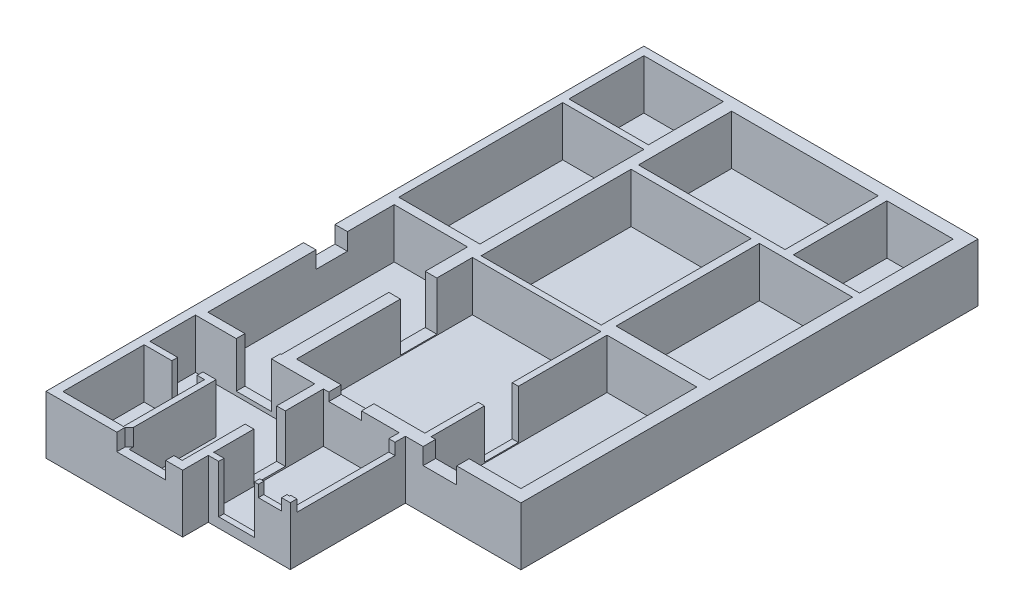
from build123d import *

# Parameters (mm, degrees)
SKETCH_1_W             = 1920
SKETCH_1_H             = 1810
SKETCH_1_W_2           = 1960
SKETCH_1_H_2           = 3960
SKETCH_1_W_3           = 1600
SKETCH_1_H_3           = 2260
SKETCH_1_W_4           = 2170
SKETCH_1_H_4           = 4250
SKETCH_1_W_5           = 3540
SKETCH_1_H_5           = 2250
SKETCH_1_W_6           = 2250
SKETCH_1_H_6           = 3460
SKETCH_1_W_7           = 2900
SKETCH_1_H_7           = 3620
SKETCH_1_W_8           = 1460
SKETCH_1_H_8           = 1960
SKETCH_1_W_9           = 1830
SKETCH_1_H_9           = 2650
SKETCH_1_W_10          = 3100
SKETCH_1_W_11          = 1770
SKETCH_1_H_10          = 4500
EXTRUDE_1796_DEPTH     = 2580
EXTRUDE_2026_DEPTH     = 200
SKETCH_5_W             = 760
SKETCH_5_H             = 1290
CUT_EXTRUDE_2294_DEPTH = 12730.50759415
SKETCH_7_W             = 1180
SKETCH_7_H             = 1220
CUT_EXTRUDE_2534_DEPTH = 15092.53046452
CHAMFER_1_SIZE         = 100
CUT_EXTRUDE_2822_REACH = 12120.51
SKETCH_10_W            = 790
SKETCH_10_H            = 1070
CUT_EXTRUDE_3074_REACH = 14575.702
SKETCH_11_W            = 860
SKETCH_11_H            = 1930
CUT_EXTRUDE_3320_REACH = 13130.454
SKETCH_12_W            = 610
SKETCH_12_H            = 1730
CUT_EXTRUDE_3576_REACH = 11929.514
SKETCH_13_W            = 850
SKETCH_13_H            = 1850
CUT_EXTRUDE_3824_REACH = 11735.178
SKETCH_15_W            = 880
SKETCH_15_H            = 1775
CUT_EXTRUDE_4057_REACH = 11847.855
SKETCH_16_W            = 810
SKETCH_16_H            = 1240
CUT_EXTRUDE_4303_REACH = 11463.674
SKETCH_17_W            = 820
SKETCH_17_H            = 2055
CUT_EXTRUDE_4598_REACH = 14575.702
SKETCH_19_W            = 560
SKETCH_19_H            = 1150
CUT_EXTRUDE_4844_REACH = 11315.017
SKETCH_20_W            = 2370
SKETCH_20_H            = 1150
CUT_EXTRUDE_5188_REACH = 11247.793
SKETCH_22_W            = 760
SKETCH_22_H            = 1890
SKETCH_21_W            = 8095.85133769
SKETCH_21_H            = 14487.658310263
CUT_EXTRUDE_5242_DEPTH = 1380


with BuildPart() as part:
    # Эскиз1 → Extrude 1796 (new body)
    with BuildSketch(Plane(origin=(0, 0, 0), x_dir=(1, 0, 0), z_dir=(0, 1, 0))):
        Polygon((-3789.779005525, -9747.361878453), (-489.779005525, -9747.361878453), (-489.779005525, -9127.361878453), (1490.220994475, -9127.361878453), (1490.220994475, -6347.361878453), (4280.220994475, -6347.361878453), (4280.220994475, 4692.638121547), (-3789.779005525, 4692.638121547), align=None)
        with Locations((-2629.779005525, 3587.638121547)):
            Rectangle(SKETCH_1_W, SKETCH_1_H, mode=Mode.SUBTRACT)
        with Locations((-2609.779005525, 552.638121547)):
            Rectangle(SKETCH_1_W_2, SKETCH_1_H_2, mode=Mode.SUBTRACT)
        with Locations((3180.220994475, 3262.638121547)):
            Rectangle(SKETCH_1_W_3, SKETCH_1_H_3, mode=Mode.SUBTRACT)
        with Locations((2895.220994475, -3922.361878453)):
            Rectangle(SKETCH_1_W_4, SKETCH_1_H_4, mode=Mode.SUBTRACT)
        with Locations((400.220994475, 3267.638121547)):
            Rectangle(SKETCH_1_W_5, SKETCH_1_H_5, mode=Mode.SUBTRACT)
        with Locations((2855.220994475, 232.638121547)):
            Rectangle(SKETCH_1_W_6, SKETCH_1_H_6, mode=Mode.SUBTRACT)
        with Locations((80.220994475, 152.638121547)):
            Rectangle(SKETCH_1_W_7, SKETCH_1_H_7, mode=Mode.SUBTRACT)
        Polygon((-699.779005525, -6347.361878453), (-699.779005525, -9547.361878453), (-1979.779005525, -9547.361878453), (-1979.779005525, -7447.361878453), (-3579.779005525, -7447.361878453), (-3579.779005525, -6347.361878453), align=None, mode=Mode.SUBTRACT)
        with Locations((-2849.779005525, -8567.361878453)):
            Rectangle(SKETCH_1_W_8, SKETCH_1_H_8, mode=Mode.SUBTRACT)
        with Locations((425.220994475, -7672.361878453)):
            Rectangle(SKETCH_1_W_9, SKETCH_1_H_9, mode=Mode.SUBTRACT)
        with Locations((110.220994475, -3922.361878453)):
            Rectangle(SKETCH_1_W_10, SKETCH_1_H_4, mode=Mode.SUBTRACT)
        with Locations((-2604.779005525, -3887.361878453)):
            Rectangle(SKETCH_1_W_11, SKETCH_1_H_10, mode=Mode.SUBTRACT)
    extrude(amount=EXTRUDE_1796_DEPTH)

    # Эскиз4 → Extrude 2026 (add)
    with BuildSketch(Plane(origin=(0, 0, 0), x_dir=(1, 0, 0), z_dir=(0, 1, 0))):
        Polygon((-3789.779005525, 4692.638121547), (4280.220994475, 4692.638121547), (4280.220994475, -6347.361878453), (1490.220994475, -6347.361878453), (1490.220994475, -9127.361878453), (-489.779005525, -9127.361878453), (-489.779005525, -9747.361878453), (-3789.779005525, -9747.361878453), align=None)
    extrude(amount=-EXTRUDE_2026_DEPTH)

    # Эскиз5 → Cut-Extrude 2294 (cut, through all)
    with BuildSketch(Plane(origin=(-3489.779005525, 0, 0), x_dir=(0, 0, -1), z_dir=(1, 0, 0))):
        with Locations((-3147.361878453, 1435)):
            Rectangle(SKETCH_5_W, SKETCH_5_H)
    extrude(amount=-CUT_EXTRUDE_2294_DEPTH, mode=Mode.SUBTRACT)

    # Эскиз7 → Cut-Extrude 2534 (cut, through all)
    with BuildSketch(Plane(origin=(0, 0, 9547.361878453), x_dir=(-1, 0, 0), z_dir=(0, 0, -1))):
        with Locations((1489.779005525, 1400)):
            Rectangle(SKETCH_7_W, SKETCH_7_H)
    extrude(amount=-CUT_EXTRUDE_2534_DEPTH, mode=Mode.SUBTRACT)

    # Фаска1
    chamfer_1_edges = [part.edges().sort_by_distance(p)[0] for p in [
        (-1979.779005525, 1400, 9547.361878453),
    ]]
    chamfer(chamfer_1_edges, length=CHAMFER_1_SIZE - 0.0001)  # a hair under: the kernel refuses the full size

    # Эскиз10 → Cut-Extrude 2822 (cut, up to next)
    with BuildSketch(Plane.XY.offset(6347.361878453), mode=Mode.PRIVATE) as cut_extrude_2822_sk1:
        with Locations((35.220994475, 1535)):
            Rectangle(SKETCH_10_W, SKETCH_10_H)
    cut_extrude_2822_tool1 = extrude(cut_extrude_2822_sk1.sketch, amount=-CUT_EXTRUDE_2822_REACH, mode=Mode.PRIVATE) & part.part
    add(cut_extrude_2822_tool1.solids().sort_by_distance((35.220994, 1535, 6347.361878))[0], mode=Mode.SUBTRACT)

    # Эскиз11 → Cut-Extrude 3074 (cut, up to next)
    with BuildSketch(Plane(origin=(0, 0, 8997.361878453), x_dir=(-1, 0, 0), z_dir=(0, 0, -1)), mode=Mode.PRIVATE) as cut_extrude_3074_sk1:
        with Locations((-190.220994475, 1005)):
            Rectangle(SKETCH_11_W, SKETCH_11_H)
    cut_extrude_3074_tool1 = extrude(cut_extrude_3074_sk1.sketch, amount=-CUT_EXTRUDE_3074_REACH, mode=Mode.PRIVATE) & part.part
    add(cut_extrude_3074_tool1.solids().sort_by_distance((190.220994, 1005, 8997.361878))[0], mode=Mode.SUBTRACT)

    # Эскиз12 → Cut-Extrude 3320 (cut, up to next)
    with BuildSketch(Plane(origin=(0, 0, 7447.361878453), x_dir=(-1, 0, 0), z_dir=(0, 0, -1)), mode=Mode.PRIVATE) as cut_extrude_3320_sk1:
        with Locations((2604.779005525, 1015)):
            Rectangle(SKETCH_12_W, SKETCH_12_H)
    cut_extrude_3320_tool1 = extrude(cut_extrude_3320_sk1.sketch, amount=-CUT_EXTRUDE_3320_REACH, mode=Mode.PRIVATE) & part.part
    add(cut_extrude_3320_tool1.solids().sort_by_distance((-2604.779006, 1015, 7447.361878))[0], mode=Mode.SUBTRACT)

    # Эскиз13 → Cut-Extrude 3576 (cut, up to next)
    with BuildSketch(Plane(origin=(0, 0, 6137.361878453), x_dir=(-1, 0, 0), z_dir=(0, 0, -1)), mode=Mode.PRIVATE) as cut_extrude_3576_sk1:
        with Locations((2169.779005525, 1025)):
            Rectangle(SKETCH_13_W, SKETCH_13_H)
    cut_extrude_3576_tool1 = extrude(cut_extrude_3576_sk1.sketch, amount=-CUT_EXTRUDE_3576_REACH, mode=Mode.PRIVATE) & part.part
    add(cut_extrude_3576_tool1.solids().sort_by_distance((-2169.779006, 1025, 6137.361878))[0], mode=Mode.SUBTRACT)

    # Эскиз15 → Cut-Extrude 3824 (cut, up to next)
    with BuildSketch(Plane.ZY.offset(1719.779005525), mode=Mode.PRIVATE) as cut_extrude_3824_sk1:
        with Locations((3097.361878453, 912.5)):
            Rectangle(SKETCH_15_W, SKETCH_15_H)
    cut_extrude_3824_tool1 = extrude(cut_extrude_3824_sk1.sketch, amount=-CUT_EXTRUDE_3824_REACH, mode=Mode.PRIVATE) & part.part
    add(cut_extrude_3824_tool1.solids().sort_by_distance((-1719.779006, 912.5, 3097.361878))[0], mode=Mode.SUBTRACT)

    # Эскиз16 → Cut-Extrude 4057 (cut, up to next)
    with BuildSketch(Plane(origin=(0, 0, 6047.361878453), x_dir=(-1, 0, 0), z_dir=(0, 0, -1)), mode=Mode.PRIVATE) as cut_extrude_4057_sk1:
        with Locations((-2325.220994475, 1420)):
            Rectangle(SKETCH_16_W, SKETCH_16_H)
    cut_extrude_4057_tool1 = extrude(cut_extrude_4057_sk1.sketch, amount=-CUT_EXTRUDE_4057_REACH, mode=Mode.PRIVATE) & part.part
    add(cut_extrude_4057_tool1.solids().sort_by_distance((2325.220994, 1420, 6047.361878))[0], mode=Mode.SUBTRACT)

    # Эскиз17 → Cut-Extrude 4303 (cut, up to next)
    with BuildSketch(Plane.ZY.offset(-1660.220994475), mode=Mode.PRIVATE) as cut_extrude_4303_sk1:
        with Locations((4347.361878453, 1052.5)):
            Rectangle(SKETCH_17_W, SKETCH_17_H)
    cut_extrude_4303_tool1 = extrude(cut_extrude_4303_sk1.sketch, amount=-CUT_EXTRUDE_4303_REACH, mode=Mode.PRIVATE) & part.part
    add(cut_extrude_4303_tool1.solids().sort_by_distance((1660.220994, 1052.5, 4347.361878))[0], mode=Mode.SUBTRACT)

    # Эскиз19 → Cut-Extrude 4598 (cut, up to next)
    with BuildSketch(Plane(origin=(0, 0, 8997.361878453), x_dir=(-1, 0, 0), z_dir=(0, 0, -1)), mode=Mode.PRIVATE) as cut_extrude_4598_sk1:
        with Locations((-1000.220994475, 1495)):
            Rectangle(SKETCH_19_W, SKETCH_19_H)
    cut_extrude_4598_tool1 = extrude(cut_extrude_4598_sk1.sketch, amount=-CUT_EXTRUDE_4598_REACH, mode=Mode.PRIVATE) & part.part
    add(cut_extrude_4598_tool1.solids().sort_by_distance((1000.220994, 1495, 8997.361878))[0], mode=Mode.SUBTRACT)

    # Эскиз20 → Cut-Extrude 4844 (cut, up to next)
    with BuildSketch(Plane.ZY.offset(-1340.220994475), mode=Mode.PRIVATE) as cut_extrude_4844_sk1:
        with Locations((7782.361878453, 1495)):
            Rectangle(SKETCH_20_W, SKETCH_20_H)
    cut_extrude_4844_tool1 = extrude(cut_extrude_4844_sk1.sketch, amount=-CUT_EXTRUDE_4844_REACH, mode=Mode.PRIVATE) & part.part
    add(cut_extrude_4844_tool1.solids().sort_by_distance((1340.220994, 1495, 7782.361878))[0], mode=Mode.SUBTRACT)

    # Эскиз22 → Cut-Extrude 5188 (cut, up to next)
    with BuildSketch(Plane.ZY.offset(699.779005525), mode=Mode.PRIVATE) as cut_extrude_5188_sk1:
        with Locations((7647.361878453, 985)):
            Rectangle(SKETCH_22_W, SKETCH_22_H)
    cut_extrude_5188_tool1 = extrude(cut_extrude_5188_sk1.sketch, amount=-CUT_EXTRUDE_5188_REACH, mode=Mode.PRIVATE) & part.part
    add(cut_extrude_5188_tool1.solids().sort_by_distance((-699.779006, 985, 7647.361878))[0], mode=Mode.SUBTRACT)

    # Эскиз21 → Cut-Extrude 5242 (cut)
    with BuildSketch(Plane(origin=(0, 2580, 0), x_dir=(1, 0, 0), z_dir=(0, 1, 0))):
        with Locations((258.14666332, -2551.191033585)):
            Rectangle(SKETCH_21_W, SKETCH_21_H)
    extrude(amount=-CUT_EXTRUDE_5242_DEPTH, mode=Mode.SUBTRACT)


solid = part.part
